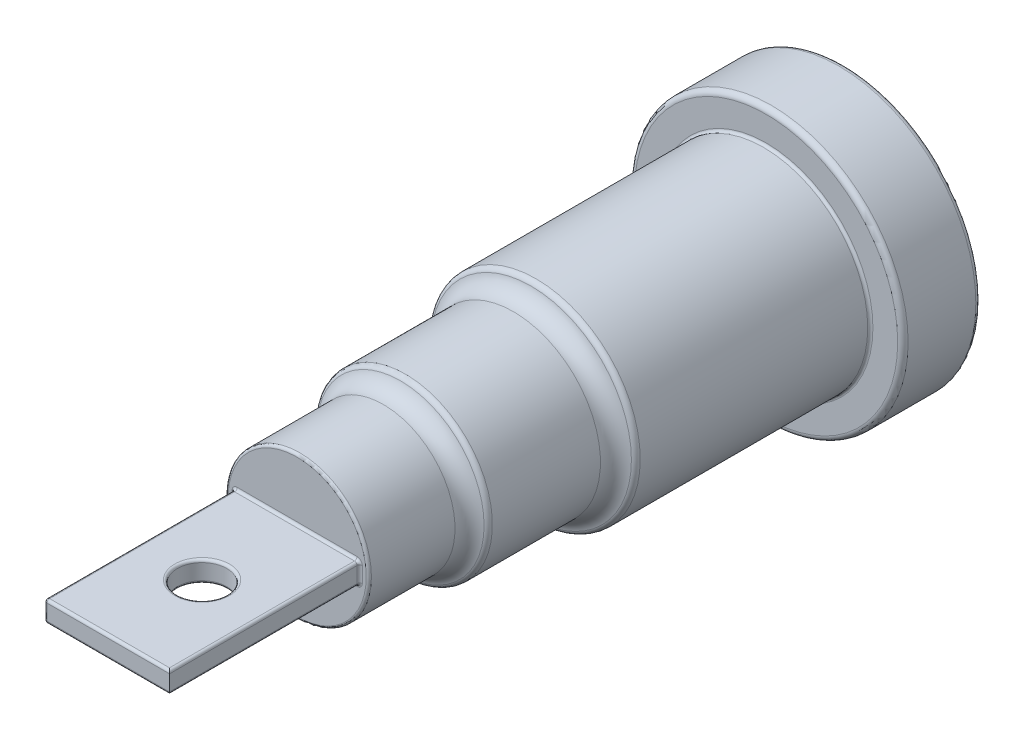
from build123d import *

# Parameters (mm, degrees)
SKETCH2_R           = 5.25
BOSS_EXTRUDE1_DEPTH = 3
SKETCH3_R           = 4
BOSS_EXTRUDE2_DEPTH = 9
SKETCH4_R           = 3.34
BOSS_EXTRUDE3_DEPTH = 5
SKETCH5_R           = 2.75
BOSS_EXTRUDE4_DEPTH = 4
SKETCH6_W           = 4.8
SKETCH6_H           = 0.8
BOSS_EXTRUDE5_DEPTH = 7.3
SKETCH7_R           = 0.95
CUT_EXTRUDE1_DEPTH  = 30.332149597
SKETCH8_R           = 2.5
CUT_EXTRUDE2_DEPTH  = 15
FILLET1_R           = 0.1
FILLET2_R           = 0.1
FILLET3_R           = 0.7
FILLET5_R           = 0.2
FILLET6_R           = 0.2
CHAMFER1_SIZE       = 1


with BuildPart() as part:
    # Sketch2 → Boss-Extrude1 (new body)
    with BuildSketch(Plane.XY):
        Circle(SKETCH2_R)
    extrude(amount=BOSS_EXTRUDE1_DEPTH)

    # Sketch3 → Boss-Extrude2 (add)
    with BuildSketch(Plane.XY.offset(3)):
        Circle(SKETCH3_R)
    extrude(amount=BOSS_EXTRUDE2_DEPTH)

    # Sketch4 → Boss-Extrude3 (add)
    with BuildSketch(Plane.XY.offset(12)):
        Circle(SKETCH4_R)
    extrude(amount=BOSS_EXTRUDE3_DEPTH)

    # Sketch5 → Boss-Extrude4 (add)
    with BuildSketch(Plane.XY.offset(17)):
        Circle(SKETCH5_R)
    extrude(amount=BOSS_EXTRUDE4_DEPTH)

    # Sketch6 → Boss-Extrude5 (add)
    with BuildSketch(Plane.XY.offset(21)):
        Rectangle(SKETCH6_W, SKETCH6_H)
    extrude(amount=BOSS_EXTRUDE5_DEPTH)

    # Sketch7 → Cut-Extrude1 (cut, through all)
    with BuildSketch(Plane.XZ.offset(0.4)):
        with Locations(Location((0, 24.65, 0), (0, 0, 270))):
            Circle(SKETCH7_R)
    extrude(amount=-CUT_EXTRUDE1_DEPTH, mode=Mode.SUBTRACT)

    # Sketch8 → Cut-Extrude2 (cut)
    with BuildSketch(Plane(origin=(0, 0, 0), x_dir=(-1, 0, 0), z_dir=(0, 0, -1))):
        Circle(SKETCH8_R)
    extrude(amount=-CUT_EXTRUDE2_DEPTH, mode=Mode.SUBTRACT)

    # Fillet1
    fillet1_edges = [part.edges().sort_by_distance(p)[0] for p in [
        (-2.75, 0, 21),
        (2.4, 0, 21),
        (2.4, -0.4, 24.65),
        (0, 0.4, 21),
        (2.4, 0.4, 24.65),
        (-2.4, 0, 21),
        (-2.4, 0.4, 24.65),
        (0, -0.4, 21),
        (-2.4, -0.4, 24.65),
        (0, 0.4, 28.3),
        (-2.4, 0, 28.3),
        (0, -0.4, 28.3),
        (0, 0.4, 25.6),
        (0, -0.4, 25.6),
    ]]
    fillet(fillet1_edges, radius=FILLET1_R)

    # Fillet2
    fillet2_edges = [part.edges().sort_by_distance(p)[0] for p in [
        (-4, 0, 3),
    ]]
    fillet(fillet2_edges, radius=FILLET2_R)

    # Fillet3
    # the kernel refuses this fillet: 0.7 mm, written as the material it adds along each edge
    with BuildSketch(Plane(origin=(0, 0, 12), x_dir=(1, 0, 0), z_dir=(0, -1, 0))) as fillet3_piece_1:
        with BuildLine():
            CenterArc((4.04, 0.698856208), FILLET3_R, 180, 86.72417104)
            Line((3.34, 0.698856208), (3.326, 0.698856208))
            Line((3.326, 0.698856208), (3.326, 0))
            Line((3.326, 0), (3.34, -0.014))
            ThreePointArc((3.34, -0.014), (3.67, -0.014), (3.9992, -0.013977124))
            Line((3.9992, -0.013977124), (4, 0))
        make_face()
    revolve(axis=Axis((0, 0, 12), (0, 0, 1)))
    with BuildSketch(Plane(origin=(0, 0, 17), x_dir=(1, 0, 0), z_dir=(0, -1, 0))) as fillet3_piece_2:
        with BuildLine():
            CenterArc((3.45, 0.691303117), FILLET3_R, 180, 80.958903851)
            Line((2.75, 0.691303117), (2.736, 0.691303117))
            Line((2.736, 0.691303117), (2.736, 0))
            Line((2.736, 0), (2.75, -0.014))
            ThreePointArc((2.75, -0.014), (3.045, -0.014), (3.3378, -0.013826062))
            Line((3.3378, -0.013826062), (3.34, 0))
        make_face()
    revolve(axis=Axis((0, 0, 17), (0, 0, 1)))

    # Fillet5
    fillet5_edges = [part.edges().sort_by_distance(p)[0] for p in [
        (-3.34, 0, 17),
        (-4, 0, 12),
    ]]
    fillet(fillet5_edges, radius=FILLET5_R)

    # Fillet6
    fillet6_edges = [part.edges().sort_by_distance(p)[0] for p in [
        (-5.25, 0, 0),
        (-5.25, 0, 3),
    ]]
    fillet(fillet6_edges, radius=FILLET6_R)

    # Chamfer1
    chamfer1_edges = [part.edges().sort_by_distance(p)[0] for p in [
        (2.5, 0, 0),
    ]]
    chamfer(chamfer1_edges, length=CHAMFER1_SIZE)


solid = part.part
